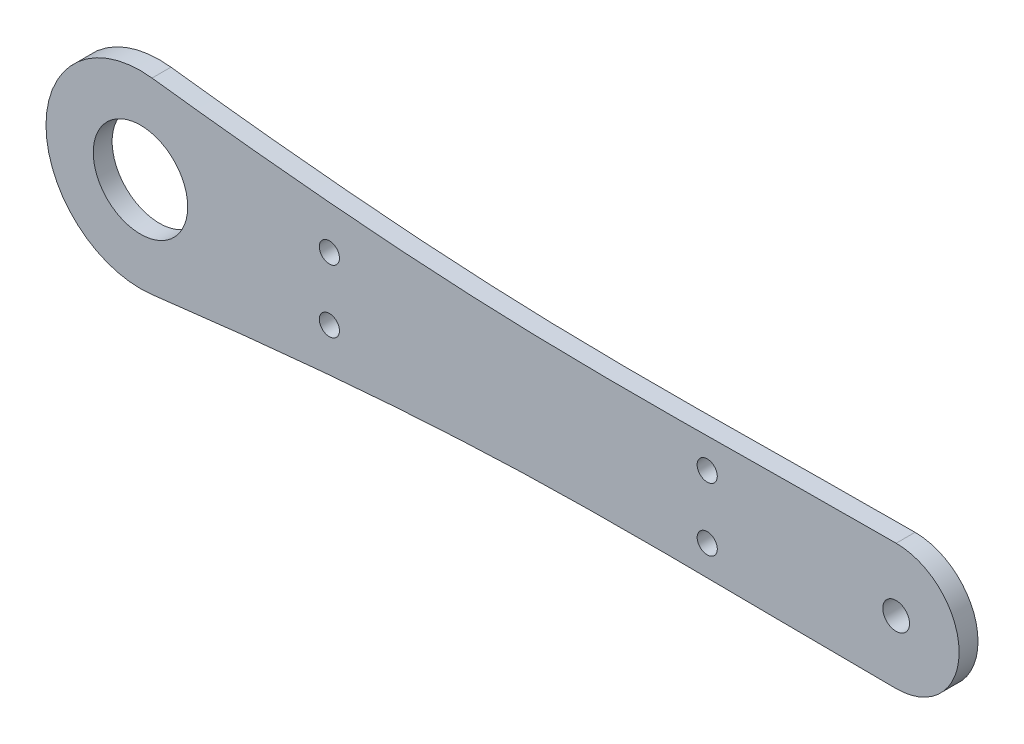
from build123d import *

# Parameters (mm, degrees)
SKETCH1_R           = 7.5
SKETCH1_R_2         = 2.125
SKETCH1_R_3         = 1.6
BOSS_EXTRUDE1_DEPTH = 3


with BuildPart() as part:
    # Sketch1 → Boss-Extrude1 (new body)
    with BuildSketch(Plane.XY):
        with BuildLine():
            ThreePointArc((-58.162175395, 14.886987631), (-75, 0), (-58.162175395, -14.886987631))
            add(Edge.make_bspline(
                [(60, -10), (39.938914406, -10), (0.518378334, -8.716527275), (-38.803194603, -12.497087104), (-58.162175395, -14.886987631)],
                knots=[0, 0, 0, 0, 0.506897502, 1, 1, 1, 1], degree=3))
            ThreePointArc((60, -10), (70, 0), (60, 10))
            add(Edge.make_bspline(
                [(60, 10), (39.938914406, 10), (0.518378334, 8.716527275), (-38.803194603, 12.497087104), (-58.162175395, 14.886987631)],
                knots=[0, 0, 0, 0, 0.506897502, 1, 1, 1, 1], degree=3))
        make_face()
        with Locations((-60, 0)):
            Circle(SKETCH1_R, mode=Mode.SUBTRACT)
        with Locations((60, 0)):
            Circle(SKETCH1_R_2, mode=Mode.SUBTRACT)
        with Locations((-30, 5)):
            Circle(SKETCH1_R_3, mode=Mode.SUBTRACT)
        with Locations((30, 5)):
            Circle(SKETCH1_R_3, mode=Mode.SUBTRACT)
        with Locations((30, -5)):
            Circle(SKETCH1_R_3, mode=Mode.SUBTRACT)
        with Locations((-30, -5)):
            Circle(SKETCH1_R_3, mode=Mode.SUBTRACT)
    extrude(amount=BOSS_EXTRUDE1_DEPTH)


solid = part.part
